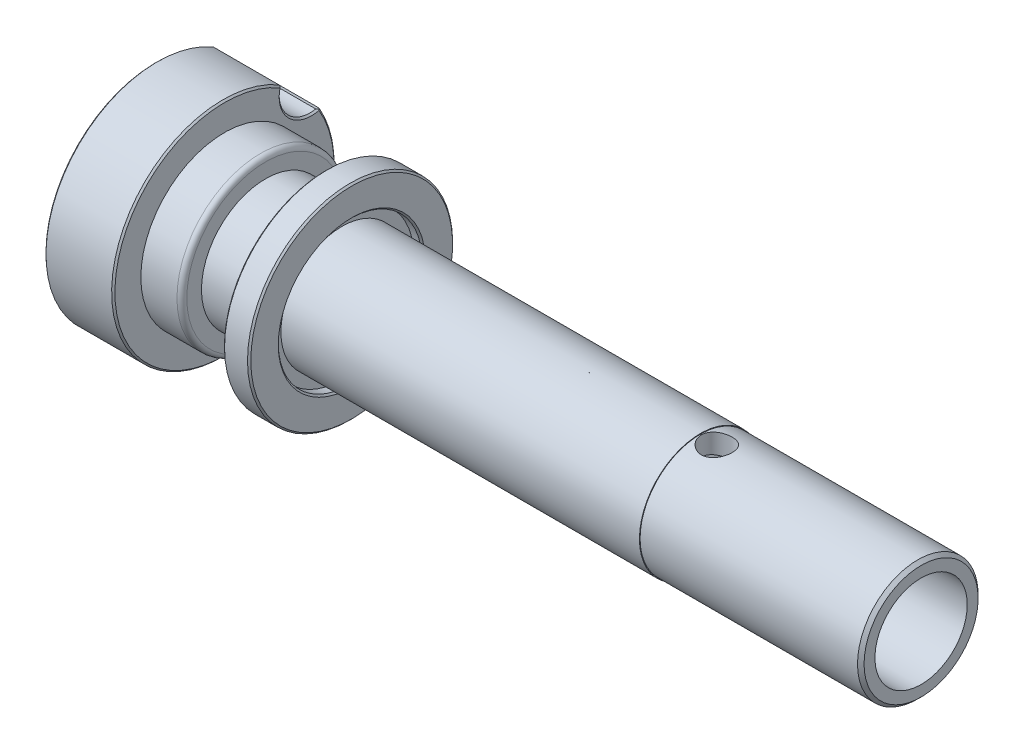
from build123d import *

# Parameters (mm, degrees)
CHAMFER1_SIZE                   = 0.508
CHAMFER2_SIZE                   = 0.254
FILLET1_R                       = 0.762
F_6_32_TAPPED_HOLE1_D           = 2.7051
F_6_32_TAPPED_HOLE1_DEPTH       = 8.07730597
F_6_32_TAPPED_HOLE1_CSINK_D     = 3.81
F_6_32_TAPPED_HOLE1_CSINK_ANGLE = 90
F_6_32_TAPPED_HOLE1_TIP         = 0.81269403
CUT_EXTRUDE1_REACH              = 122.968
SKETCH4_R                       = 4.7625
CHAMFER3_SIZE                   = 0.254
SKETCH5_R                       = 7.9375
CUT_EXTRUDE2_DEPTH              = 9.78408
SKETCH6_R                       = 11.1125
CUT_EXTRUDE3_DEPTH              = 1.5875
CHAMFER4_SIZE                   = 0.508
CUT_EXTRUDE4_DEPTH              = 121.967997999
CUT_EXTRUDE4_DEPTH_BACK         = 121.967997999
SKETCH7_R                       = 2.38125
CUT_EXTRUDE5_DEPTH              = 92.440945536
CUT_EXTRUDE5_DEPTH_BACK         = 1.524
SKETCH8_R                       = 11.1125
SKETCH8_R_2                     = 9.4361
CHAMFER5_SIZE                   = 0.254
SKETCH9_R                       = 7.14375
CUT_EXTRUDE6_DEPTH              = 12.7
CUT_EXTRUDE7_START              = -12.7
SKETCH10_R                      = 7.14375
CUT_EXTRUDE7_DEPTH              = 12.7


with BuildPart() as part:
    # Sketch1 → Revolve1 (revolve)
    with BuildSketch(Plane(origin=(0, 0, 0), x_dir=(1, 0, 0), z_dir=(0, 1, 0)), mode=Mode.PRIVATE) as revolve1_sk:
        Polygon((0, 6.35), (118.491, 6.35), (118.491, 9.3345), (84.328, 9.3345), (84.328, 9.4361), (30.353, 9.4361), (30.353, 15.875), (26.289, 15.875), (26.289, 9.921875), (17.018, 9.921875), (17.018, 12.954), (10.668, 12.954), (10.668, 17.2212), (0, 17.2212), align=None)
    revolve(revolve1_sk.sketch.rotate(Axis((0, 0, 0), (1, 0, 0)), 180), axis=Axis((0, 0, 0), (1, 0, 0)))

    # Chamfer1
    chamfer1_edges = [part.edges().sort_by_distance(p)[0] for p in [
        (118.491, 0, -9.3345),
    ]]
    chamfer(chamfer1_edges, length=CHAMFER1_SIZE)

    # Chamfer2
    chamfer2_edges = [part.edges().sort_by_distance(p)[0] for p in [
        (0, 0, -17.2212),
        (10.668, 0, -17.2212),
        (26.289, 0, -15.875),
        (30.353, 0, -15.875),
    ]]
    chamfer(chamfer2_edges, length=CHAMFER2_SIZE)

    # Fillet1
    fillet1_edges = [part.edges().sort_by_distance(p)[0] for p in [
        (17.018, 0, -12.954),
    ]]
    fillet(fillet1_edges, radius=FILLET1_R)

    # #6-32 Tapped Hole1
    with Locations(Plane.ZY):
        with Locations((0, 15.08125), (15.08125, 0), (0, -15.08125), (-15.08125, 0)):
            CounterSinkHole(F_6_32_TAPPED_HOLE1_D / 2, F_6_32_TAPPED_HOLE1_CSINK_D / 2, depth=F_6_32_TAPPED_HOLE1_DEPTH, counter_sink_angle=F_6_32_TAPPED_HOLE1_CSINK_ANGLE)
            with Locations((0, 0, -(F_6_32_TAPPED_HOLE1_DEPTH + F_6_32_TAPPED_HOLE1_TIP / 2))):  # 118° drill point
                Cone(0, F_6_32_TAPPED_HOLE1_D / 2, F_6_32_TAPPED_HOLE1_TIP, mode=Mode.SUBTRACT)

    # Sketch4 → Cut-Extrude1 (cut, up to next)
    with BuildSketch(Plane.ZY, mode=Mode.PRIVATE) as cut_extrude1_sk1:
        with Locations((-13.470384182, 13.470384182)):
            Circle(SKETCH4_R)
    cut_extrude1_tool1 = extrude(cut_extrude1_sk1.sketch, amount=-CUT_EXTRUDE1_REACH, mode=Mode.PRIVATE) & part.part
    add(cut_extrude1_tool1.solids().sort_by_distance((0, 13.470384, -13.470384))[0], mode=Mode.SUBTRACT)

    # Chamfer3
    # the kernel refuses this chamfer: 0.363987464, 0.254 mm, written as the material it takes off along each edge
    with BuildSketch(Plane(origin=(10.668, 13.470384182, -13.470384182), x_dir=(0, -0.9379671021668624, -0.34672426400916706), z_dir=(0, 0.34672426400916706, -0.9379671021668624))) as chamfer3_piece_1:
        Polygon((4.7625 + CHAMFER3_SIZE, 0), (4.7625, CHAMFER3_SIZE), (4.7625, 0), align=None)
    revolve(axis=Axis((10.668, 13.470384182, -13.470384182), (-1, 0, 0)), revolution_arc=130.574173679, mode=Mode.SUBTRACT)
    with BuildSketch(Plane(origin=(0, 13.470384182, -13.470384182), x_dir=(0, 0.3467242640091905, 0.9379671021668536), z_dir=(-1.1910571492459259e-15, 0.9379671021668536, -0.3467242640091905))) as chamfer3_piece_2:
        Polygon((4.7625 + CHAMFER3_SIZE, 0), (4.7625, CHAMFER3_SIZE), (4.7625, 0), align=None)
    revolve(axis=Axis((0, 13.470384182, -13.470384182), (1, 0, 0)), revolution_arc=130.574173679, mode=Mode.SUBTRACT)
    with BuildSketch(Plane(origin=(11.428728949, 14.75288233, -8.88381632), x_dir=(0, 0.509579415294029, 0.8604236279348654), z_dir=(-1, 0, 0))) as chamfer3_piece_3:
        with BuildLine():
            Line((0.252160633, 0), (-0.117343909, -0.374955046))
            ThreePointArc((-0.117343909, -0.374955046), (-0.056744739, -0.194875402), (0, 0))
            ThreePointArc((0, 0), (0.131188651, 0.00046078), (0.252160633, 0))
        make_face()
    extrude(amount=12.189457898, mode=Mode.SUBTRACT)
    with BuildSketch(Plane(origin=(11.428728949, 8.88381632, -14.75288233), x_dir=(0, -0.8604236279348554, -0.5095794152940455), z_dir=(-1, 0, 0))) as chamfer3_piece_4:
        with BuildLine():
            Line((0.252160633, 0), (-0.117343909, 0.374955046))
            ThreePointArc((-0.117343909, 0.374955046), (-0.056744739, 0.194875402), (0, 0))
            ThreePointArc((0, 0), (0.131188651, -0.00046078), (0.252160633, 0))
        make_face()
    extrude(amount=12.189457898, mode=Mode.SUBTRACT)

    # Sketch5 → Cut-Extrude2 (cut)
    with BuildSketch(Plane.ZY):
        Circle(SKETCH5_R)
    extrude(amount=-CUT_EXTRUDE2_DEPTH, mode=Mode.SUBTRACT)

    # Sketch6 → Cut-Extrude3 (cut)
    with BuildSketch(Plane.ZY):
        Circle(SKETCH6_R)
    extrude(amount=-CUT_EXTRUDE3_DEPTH, mode=Mode.SUBTRACT)

    # Chamfer4
    chamfer4_edges = [part.edges().sort_by_distance(p)[0] for p in [
        (1.5875, 0, -7.9375),
    ]]
    chamfer(chamfer4_edges, length=CHAMFER4_SIZE)

    # Sketch7 → Cut-Extrude4 (cut, two sides: drawn at the far end of the back side and taken through both)
    with BuildSketch(Plane(origin=(0, 0, 0), x_dir=(1, 0, 0), z_dir=(0, 1, 0)).offset(-CUT_EXTRUDE4_DEPTH_BACK)):
        with Locations(Location((86.868, 0, 0), (0, 0, 270))):
            Circle(SKETCH7_R)
    extrude(amount=CUT_EXTRUDE4_DEPTH + CUT_EXTRUDE4_DEPTH_BACK, mode=Mode.SUBTRACT)

    # Sketch8 → Cut-Extrude5 (cut, two sides: drawn at the far end of the back side and taken through both)
    with BuildSketch(Plane(origin=(30.353, 0, 0), x_dir=(0, 0, -1), z_dir=(1, 0, 0)).offset(-CUT_EXTRUDE5_DEPTH_BACK)):
        with Locations(Location((0, 0, 0), (0, 0, 180))):
            Circle(SKETCH8_R)
        with Locations(Location((0, 0, 0), (0, 0, 180))):
            Circle(SKETCH8_R_2, mode=Mode.SUBTRACT)
    extrude(amount=CUT_EXTRUDE5_DEPTH + CUT_EXTRUDE5_DEPTH_BACK, mode=Mode.SUBTRACT)

    # Chamfer5
    chamfer5_edges = [part.edges().sort_by_distance(p)[0] for p in [
        (30.353, 0, -11.1125),
    ]]
    chamfer(chamfer5_edges, length=CHAMFER5_SIZE)

    # Sketch9 → Cut-Extrude6 (cut)
    with BuildSketch(Plane(origin=(118.491, 0, 0), x_dir=(0, 0, -1), z_dir=(1, 0, 0))):
        Circle(SKETCH9_R)
    extrude(amount=-CUT_EXTRUDE6_DEPTH, mode=Mode.SUBTRACT)

    # Sketch10 → Cut-Extrude7 (cut)
    with BuildSketch(Plane.ZY.offset(-9.78408).offset(CUT_EXTRUDE7_START)):
        with Locations(Location((0, 0, 0), (0, 0, 180))):
            Circle(SKETCH10_R)
    extrude(amount=CUT_EXTRUDE7_DEPTH, mode=Mode.SUBTRACT)


solid = part.part
